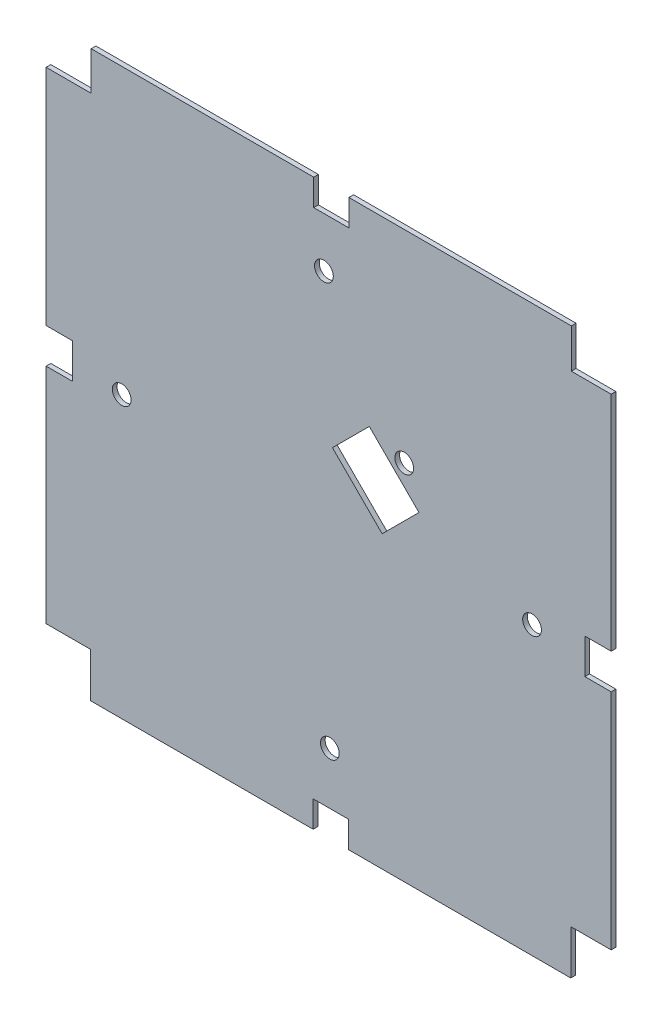
from build123d import *

# Parameters (mm, degrees)
SKETCH1_R           = 1.6
BOSS_EXTRUDE1_DEPTH = 0.8
CUT_EXTRUDE1_DEPTH  = 0.8


with BuildPart() as part:
    # Sketch1 → Boss-Extrude1 (new body)
    with BuildSketch(Plane.XY):
        Polygon((-21.328326925, 35.64702685), (-59.328326925, 35.64702685), (-59.328326925, 29.04702685), (-67.028326925, 29.04702685), (-67.028326925, -9.15297315), (-62.528326925, -9.15297315), (-62.528326925, -15.15297315), (-67.028326925, -15.15297315), (-67.028326925, -53.25297315), (-59.428326925, -53.25297315), (-59.428326925, -60.85297315), (-21.428326925, -60.85297315), (-21.428326925, -56.35297315), (-15.428326925, -56.35297315), (-15.428326925, -60.85297315), (22.571673075, -60.85297315), (22.571673075, -53.25297315), (29.471673075, -53.25297315), (29.471673075, -15.073036827), (24.971673075, -15.073036827), (24.971673075, -9.073036827), (29.471673075, -9.073036827), (29.471673075, 28.94702685), (22.671673075, 28.94702685), (22.671673075, 35.64702685), (-15.328326925, 35.64702685), (-15.328326925, 31.14702685), (-21.328326925, 31.14702685), align=None)
        with Locations((-54.124954006, -12.911818564)):
            Circle(SKETCH1_R, mode=Mode.SUBTRACT)
        with Locations((-18.578326925, -47.449600232)):
            Circle(SKETCH1_R, mode=Mode.SUBTRACT)
        with Locations((-19.587172338, 22.634808517)):
            Circle(SKETCH1_R, mode=Mode.SUBTRACT)
        with Locations((-5.870945752, 1.09702685)):
            Circle(SKETCH1_R, mode=Mode.SUBTRACT)
        with Locations((15.959454743, -11.90297315)):
            Circle(SKETCH1_R, mode=Mode.SUBTRACT)
    extrude(amount=BOSS_EXTRUDE1_DEPTH)

    # Sketch2 → Cut-Extrude1 (cut)
    with BuildSketch(Plane.XY.offset(0.8)):
        Polygon((-3.35240311, -4.96233071), (-11.837684484, 3.522950664), (-18.130934836, -2.770299688), (-9.645653462, -11.255581062), align=None)
    extrude(amount=-CUT_EXTRUDE1_DEPTH, mode=Mode.SUBTRACT)


solid = part.part
